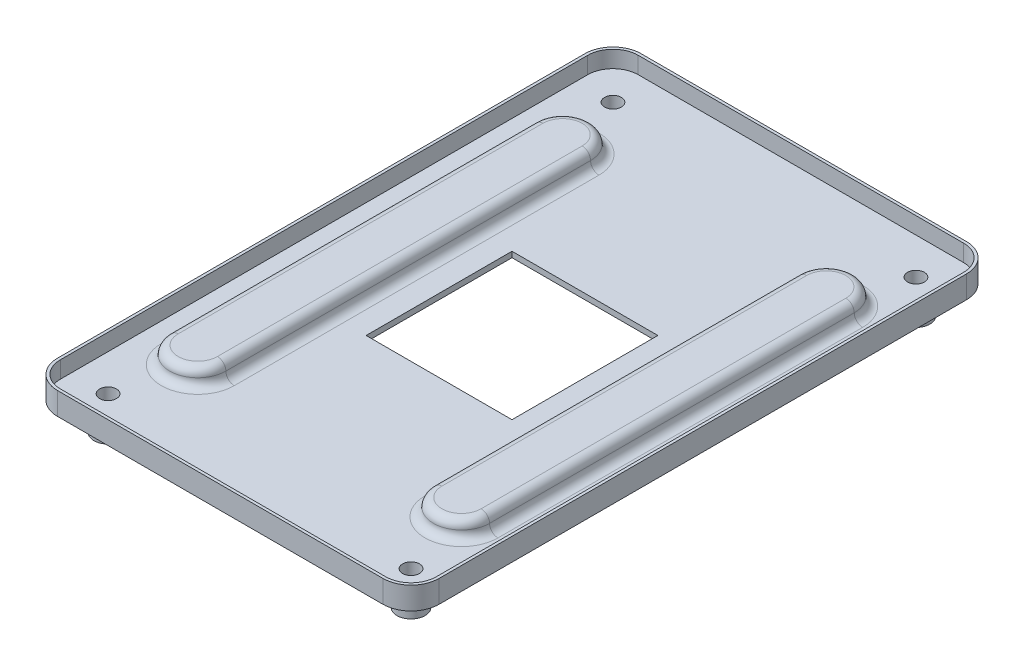
from build123d import *

# Parameters (mm, degrees)
SKETCH1_W           = 68
SKETCH1_H           = 104
SKETCH1_W_2         = 26
SKETCH1_H_2         = 26
BOSS_EXTRUDE1_DEPTH = 4
FILLET1_R           = 5
CUT_EXTRUDE1_DEPTH  = 3
FILLET2_R           = 1.5
SKETCH4_R           = 2.5
BOSS_EXTRUDE2_DEPTH = 5
SKETCH5_R           = 1.5
CUT_EXTRUDE2_DEPTH  = 63.777384463


with BuildPart() as part:
    # Sketch1 → Boss-Extrude1 (new body)
    with BuildSketch(Plane(origin=(0, 0, 0), x_dir=(1, 0, 0), z_dir=(0, 1, 0))):
        Rectangle(SKETCH1_W, SKETCH1_H)
        Rectangle(SKETCH1_W_2, SKETCH1_H_2, mode=Mode.SUBTRACT)
    extrude(amount=BOSS_EXTRUDE1_DEPTH)

    # Fillet1
    fillet1_edges = [part.edges().sort_by_distance(p)[0] for p in [
        (34, 2, 52),
        (-34, 2, 52),
        (-34, 2, -52),
        (34, 2, -52),
    ]]
    fillet(fillet1_edges, radius=FILLET1_R)

    # Sketch3 → Cut-Extrude1 (cut)
    with BuildSketch(Plane(origin=(0, 4, 0), x_dir=(1, 0, 0), z_dir=(0, 1, 0))):
        with BuildLine():
            Line((29, 51.5), (-29, 51.5))
            ThreePointArc((-29, 51.5), (-32.181980515, 50.181980515), (-33.5, 47))
            Line((-33.5, 47), (-33.5, -47))
            ThreePointArc((-33.5, -47), (-32.181980515, -50.181980515), (-29, -51.5))
            Line((-29, -51.5), (29, -51.5))
            ThreePointArc((29, -51.5), (32.181980515, -50.181980515), (33.5, -47))
            Line((33.5, -47), (33.5, 47))
            ThreePointArc((33.5, 47), (32.181980515, 50.181980515), (29, 51.5))
        make_face()
        with BuildLine():
            Line((-28.5, -32.5), (-28.5, 32.5))
            ThreePointArc((-28.5, 32.5), (-23.5, 37.5), (-18.5, 32.5))
            Line((-18.5, 32.5), (-18.5, -32.5))
            ThreePointArc((-18.5, -32.5), (-23.5, -37.5), (-28.5, -32.5))
        make_face(mode=Mode.SUBTRACT)
        with BuildLine():
            Line((18.5, -32.5), (18.5, 32.5))
            ThreePointArc((18.5, 32.5), (23.5, 37.5), (28.5, 32.5))
            Line((28.5, 32.5), (28.5, -32.5))
            ThreePointArc((28.5, -32.5), (23.5, -37.5), (18.5, -32.5))
        make_face(mode=Mode.SUBTRACT)
    extrude(amount=-CUT_EXTRUDE1_DEPTH, mode=Mode.SUBTRACT)

    # Fillet2
    fillet2_edges = [part.edges().sort_by_distance(p)[0] for p in [
        (23.5, 4, -37.5),
        (28.5, 4, 0),
        (23.5, 4, 37.5),
        (23.5, 1, -37.5),
        (28.5, 1, 0),
        (23.5, 1, 37.5),
        (-23.5, 4, -37.5),
        (-18.5, 4, 0),
        (-23.5, 4, 37.5),
        (-23.5, 1, -37.5),
        (-18.5, 1, 0),
        (-23.5, 1, 37.5),
        (18.5, 4, 0),
        (18.5, 1, 0),
        (-28.5, 4, 0),
        (-28.5, 1, 0),
    ]]
    fillet(fillet2_edges, radius=FILLET2_R - 0.0001)  # a hair under: the kernel refuses the full size

    # Sketch4 → Boss-Extrude2 (add)
    with BuildSketch(Plane.XZ):
        with Locations(Location((-27, 45, 0), (0, 0, 270))):
            Circle(SKETCH4_R)
        with Locations(Location((27, 45, 0), (0, 0, 270))):
            Circle(SKETCH4_R)
        with Locations(Location((27, -45, 0), (0, 0, 270))):
            Circle(SKETCH4_R)
        with Locations(Location((-27, -45, 0), (0, 0, 270))):
            Circle(SKETCH4_R)
    extrude(amount=BOSS_EXTRUDE2_DEPTH)

    # Sketch5 → Cut-Extrude2 (cut, through all)
    with BuildSketch(Plane.XZ.offset(5)):
        with Locations(Location((-27, 45, 0), (0, 0, 270))):
            Circle(SKETCH5_R)
        with Locations(Location((27, 45, 0), (0, 0, 270))):
            Circle(SKETCH5_R)
        with Locations(Location((27, -45, 0), (0, 0, 270))):
            Circle(SKETCH5_R)
        with Locations(Location((-27, -45, 0), (0, 0, 270))):
            Circle(SKETCH5_R)
    extrude(amount=-CUT_EXTRUDE2_DEPTH, mode=Mode.SUBTRACT)


solid = part.part
